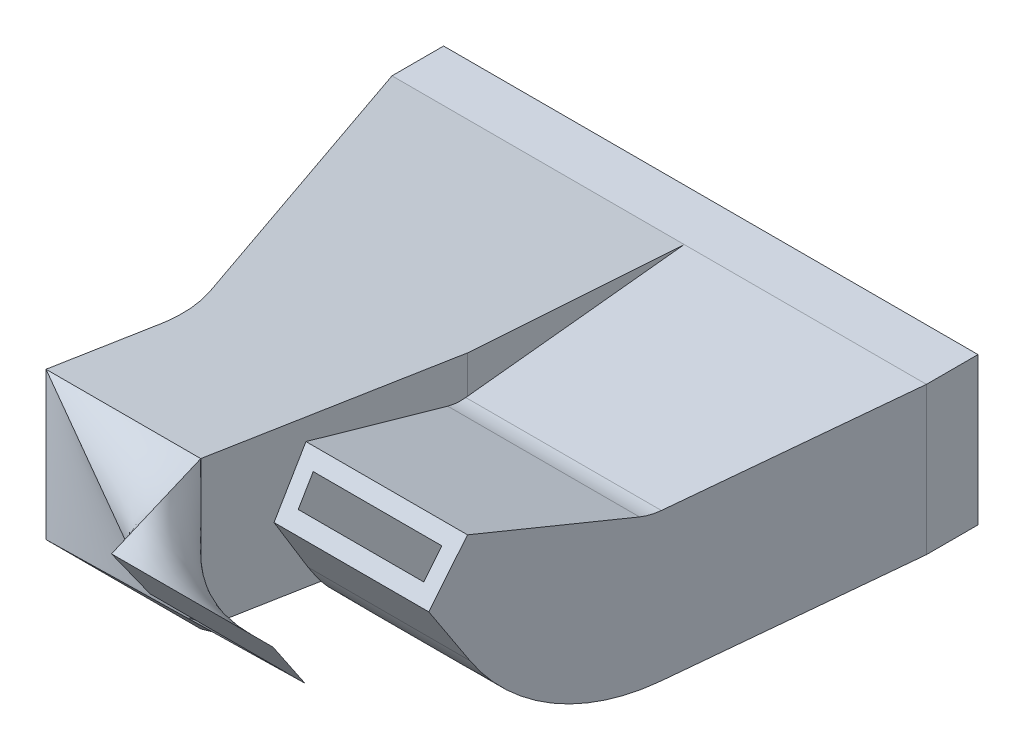
from build123d import *

# Parameters (mm, degrees)
SKETCH1_W                 = 48
SKETCH1_H                 = 10.5
SKETCH1_W_2               = 46
SKETCH1_H_2               = 8.5
EXTRUDE_THIN1_DEPTH       = 5
SKETCH5_W                 = 3.6
SKETCH5_H                 = 2.8
BOSS_EXTRUDE2_DEPTH       = 5
EXTRUDE_THIN2_DEPTH       = 5
BOSS_EXTRUDE12_START      = -3.5
SKETCH12_W                = 18.8
SKETCH12_H                = 12
BOSS_EXTRUDE12_DEPTH      = 5
CUT_EXTRUDE1_DEPTH        = 44.664745505
CUT_EXTRUDE1_DEPTH_BACK   = 44.664745505
SKETCH14_R                = 1.75
BOSS_EXTRUDE13_DEPTH      = 20
BOSS_EXTRUDE14_DEPTH      = 30
SHELL1_T                  = -1.5
BOSS_EXTRUDE15_DEPTH      = 22
BOSS_EXTRUDE16_DEPTH      = 10
BOSS_EXTRUDE16_DEPTH_BACK = 30


with BuildPart() as part:
    # Sketch1 → Extrude-Thin1 (new body)
    with BuildSketch(Plane.XY):
        Rectangle(SKETCH1_W, SKETCH1_H)
        Rectangle(SKETCH1_W_2, SKETCH1_H_2, mode=Mode.SUBTRACT)
    extrude(amount=-EXTRUDE_THIN1_DEPTH)

    # Sketch5 → Boss-Extrude2 (add)
    with BuildSketch(Plane.XY):
        with Locations((-25.8, -3.85)):
            Rectangle(SKETCH5_W, SKETCH5_H)
    extrude(amount=-BOSS_EXTRUDE2_DEPTH)


with BuildPart() as body_2:
    # Sketch6 → Extrude-Thin2 (new body)
    with BuildSketch(Plane.XY):
        Polygon((-25.9, 7.15), (-25.9, -0.55), (-29.5, -0.55), (-29.5, -7.15), (25.9, -7.15), (25.9, 7.15), align=None)
        Polygon((-24.15, 5.4), (-24.15, -2.3), (-27.75, -2.3), (-27.75, -5.4), (24.15, -5.4), (24.15, 5.4), align=None, mode=Mode.SUBTRACT)
    extrude(amount=-EXTRUDE_THIN2_DEPTH)


with BuildPart() as body_3:
    # Sketch12 → Boss-Extrude12 (new, symmetric)
    with BuildSketch(Plane(origin=(0, 0, 0), x_dir=(0, 0, -1), z_dir=(1, 0, 0)).offset(BOSS_EXTRUDE12_START)):
        with Locations((-11.6, -11.25)):
            Rectangle(SKETCH12_W, SKETCH12_H)
    extrude(amount=BOSS_EXTRUDE12_DEPTH, both=True)

    # Sketch14 → Cut-Extrude1 (cut, two sides: drawn at the far end of the back side and taken through both)
    with BuildSketch(Plane.XZ.offset(17.25).offset(-CUT_EXTRUDE1_DEPTH_BACK)):
        with Locations(Location((-3.5, 18.1, 0), (0, 0, 270))):
            Circle(SKETCH14_R)
        with Locations(Location((-3.5, 5.1, 0), (0, 0, 270))):
            Circle(SKETCH14_R)
    extrude(amount=CUT_EXTRUDE1_DEPTH + CUT_EXTRUDE1_DEPTH_BACK, mode=Mode.SUBTRACT)


with BuildPart() as body_4:
    # Sketch17 → Boss-Extrude13 (new body)
    with BuildSketch(Plane.XZ.offset(7.15)):
        Polygon((2.426563759, 0), (14.163281879, 0), (14.163281879, 44), (6.663281879, 44), (4.663281879, 23.22920584), align=None)
        Polygon((14.163281879, 0), (25.9, 0), (21.663281879, 44), (14.163281879, 44), align=None)
    extrude(amount=-BOSS_EXTRUDE13_DEPTH)


with BuildPart() as body_5:
    # Sketch18 → Boss-Extrude14 (new, along a direction that is not the sketch's normal)
    with BuildSketch(Plane(origin=(25.662072026, 0, 2.47097649), x_dir=(0.0958457525202189, 0, -0.9953961983671794), z_dir=(0.9953961983671794, 0, 0.0958457525202189))):
        with BuildLine():
            Line((2.48240499, -7.15), (2.48240499, 7.15))
            Line((2.48240499, 7.15), (-21.059394801, 7.15))
            ThreePointArc((-21.059394801, 7.15), (-22.043031658, 7.233288759), (-22.998659663, 7.480783408))
            Line((-22.998659663, 7.480783408), (-38.279640556, 12.85))
            Line((-38.279640556, 12.85), (-41.721099174, 7.935087734))
            Line((-41.721099174, 7.935087734), (-38.058045186, 2.180185533))
            ThreePointArc((-38.058045186, 2.180185533), (-30.754838022, -4.664112793), (-21.059394801, -7.15))
            Line((-21.059394801, -7.15), (2.48240499, -7.15))
        make_face()
    extrude(amount=-BOSS_EXTRUDE14_DEPTH, dir=(1, 0, 0))

    # Combine1: intersect body 4
    add(body_4.part, mode=Mode.INTERSECT)

    # Shell1
    shell1_openings = [body_5.faces().sort_by_distance(p)[0] for p in [
        (14.163281879, 10.410169392, 42.27490788),
        (14.163281879, 0, 0),
    ]]
    offset(amount=SHELL1_T, openings=shell1_openings, kind=Kind.INTERSECTION)


with BuildPart() as body_5_2:
    # Sketch17<3> → Boss-Extrude15 (new body)
    with BuildSketch(Plane.XZ.offset(7.15)):
        with BuildLine():
            Line((-25.9, 0), (2.426563759, 0))
            Line((2.426563759, 0), (4.663281879, 23.22920584))
            Line((4.663281879, 23.22920584), (4.663281879, 49.102343279))
            Line((4.663281879, 49.102343279), (-10.336718121, 49.102343279))
            Line((-10.336718121, 49.102343279), (-10.336718121, 38))
            ThreePointArc((-10.336718121, 38), (-10.667124787, 34.869020691), (-11.643788978, 31.875974241))
            Line((-11.643788978, 31.875974241), (-25.9, 0))
        make_face()
    extrude(amount=-BOSS_EXTRUDE15_DEPTH)


with BuildPart() as body_6:
    # Sketch19 → Boss-Extrude16 (new, two sides: drawn at the far end of the back side and taken through both)
    with BuildSketch(Plane(origin=(0, 0, 0), x_dir=(0, 0, -1), z_dir=(1, 0, 0)).offset(-BOSS_EXTRUDE16_DEPTH_BACK)):
        Polygon((0, -7.15), (-49.102343279, 0.55), (-49.102343279, 14.85), (0, 7.15), align=None)
    extrude(amount=BOSS_EXTRUDE16_DEPTH + BOSS_EXTRUDE16_DEPTH_BACK)


with BuildPart() as body_5_2_1:
    add(body_5_2.part)

    # Combine2: intersect body 6
    add(body_6.part, mode=Mode.INTERSECT)

    # Loft4: read off the stored shape, not the designer's step
    # Loft4: loft between two sections, ruled curve by curve
    loft4_from = [
        Edge.make_bspline([(-10.336718121, 14.85, 49.102343279), (-10.336718121, 12.466666667, 49.102343279), (-10.336718121, 10.083333333, 49.102343279), (-10.336718121, 5.316666667, 49.102343279), (-10.336718121, 2.933333333, 49.102343279), (-10.336718121, 0.55, 49.102343279)], [0, 0, 0, 0, 0.5, 0.5, 1, 1, 1, 1], 3),
        Edge.make_bspline([(-10.336718121, 0.55, 49.102343279), (-7.836718121, 0.55, 49.102343279), (-5.336718121, 0.55, 49.102343279), (-0.336718121, 0.55, 49.102343279), (2.163281879, 0.55, 49.102343279), (4.663281879, 0.55, 49.102343279)], [0, 0, 0, 0, 0.5, 0.5, 1, 1, 1, 1], 3),
        Edge.make_bspline([(4.663281879, 14.85, 49.102343279), (2.163281879, 14.85, 49.102343279), (-0.336718121, 14.85, 49.102343279), (-5.336718121, 14.85, 49.102343279), (-7.836718121, 14.85, 49.102343279), (-10.336718121, 14.85, 49.102343279)], [0, 0, 0, 0, 0.5, 0.5, 1, 1, 1, 1], 3),
        Edge.make_bspline([(4.663281879, 0.55, 49.102343279), (4.663281879, 2.933333333, 49.102343279), (4.663281879, 5.316666667, 49.102343279), (4.663281879, 10.083333333, 49.102343279), (4.663281879, 12.466666667, 49.102343279), (4.663281879, 14.85, 49.102343279)], [0, 0, 0, 0, 0.5, 0.5, 1, 1, 1, 1], 3),
    ]
    loft4_to = [
        Edge.make_bspline([(6.663281879, 7.935087734, 56), (9.163281879, 7.935087734, 56), (11.663281879, 7.935087734, 56), (16.663281879, 7.935087734, 56), (19.163281879, 7.935087734, 56), (21.663281879, 7.935087734, 56)], [0, 0, 0, 0, 0.5, 0.5, 1, 1, 1, 1], 3),
        Edge.make_bspline([(21.663281879, 7.935087734, 56), (21.718256744, 8.754239779, 56.570935804), (21.77323161, 9.573391823, 57.141871608), (21.88318134, 11.211695911, 58.283743217), (21.938156205, 12.030847956, 58.854679021), (21.99313107, 12.85, 59.425614825)], [0, 0, 0, 0, 0.5, 0.5, 1, 1, 1, 1], 3),
        Edge.make_bspline([(6.333432688, 12.85, 59.425614825), (6.388407553, 12.030847956, 58.854679021), (6.443382419, 11.211695911, 58.283743217), (6.553332149, 9.573391823, 57.141871608), (6.608307014, 8.754239779, 56.570935804), (6.663281879, 7.935087734, 56)], [0, 0, 0, 0, 0.5, 0.5, 1, 1, 1, 1], 3),
        Edge.make_bspline([(21.99313107, 12.85, 59.425614825), (19.38318134, 12.85, 59.425614825), (16.77323161, 12.85, 59.425614825), (11.553332149, 12.85, 59.425614825), (8.943382419, 12.85, 59.425614825), (6.333432688, 12.85, 59.425614825)], [0, 0, 0, 0, 0.5, 0.5, 1, 1, 1, 1], 3),
    ]
    loft4 = Solid(Shell([*[Face.make_surface_from_curves(loft4_from[k], loft4_to[k]) for k in range(4)], Face(Wire(loft4_from)), Face(Wire(loft4_to))]))
    add(loft4)


solid = Compound([part.part, body_2.part, body_3.part, body_5.part, body_5_2_1.part])
